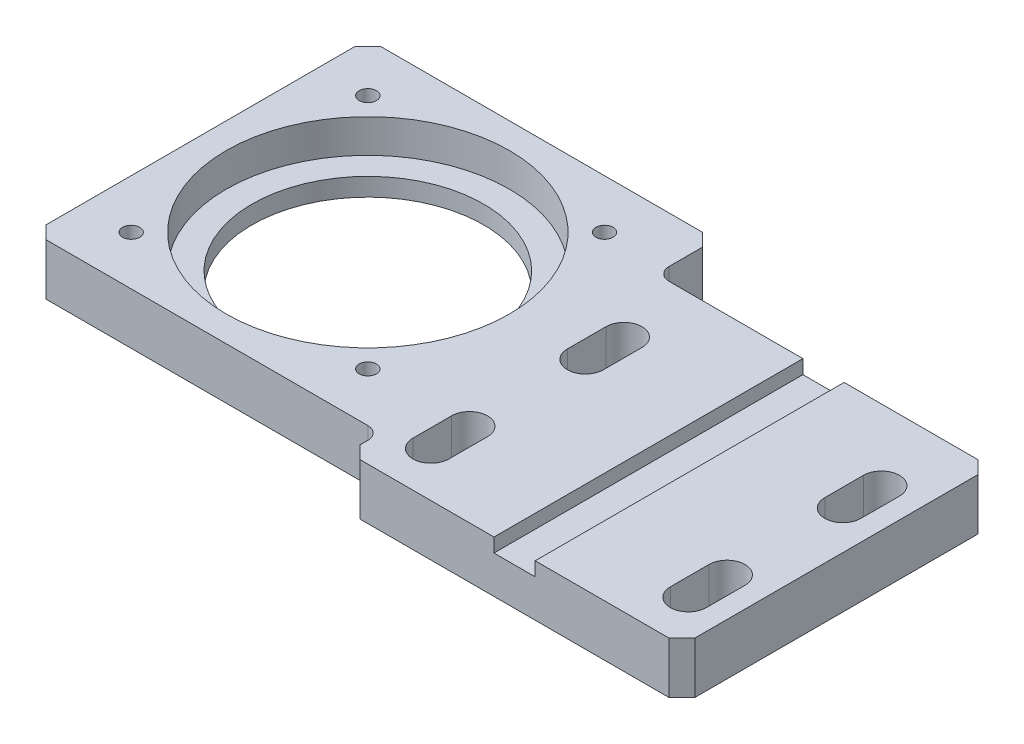
from build123d import *

# Parameters (mm, degrees)
EXTRUDE_1_DEPTH             = 20
SKETCH_3_R                  = 45
CUT_EXTRUDE_1_DEPTH         = 302.784691461
SKETCH_4_R                  = 55
CUT_EXTRUDE_2_DEPTH         = 13
SKETCH_5_W                  = 16
SKETCH_5_H                  = 120
CUT_EXTRUDE_3_DEPTH         = 5.4
CUT_EXTRUDE_4_DEPTH         = 302.784691461
PATTERN_LINEAR_1_COUNT      = 2
PATTERN_LINEAR_1_PITCH      = 60
PATTERN_LINEAR_1_COUNT_DIR2 = 2
PATTERN_LINEAR_1_PITCH_DIR2 = 100
FILLET_1_R                  = 5
CHAMFER_1_SIZE              = 5
SKETCH_7_R                  = 3.35
CUT_EXTRUDE_5_DEPTH         = 302.784691461


with BuildPart() as part:
    # 草图2 → 凸台-拉伸1 (new body)
    with BuildSketch(Plane(origin=(0, 0, 0), x_dir=(1, 0, 0), z_dir=(0, 1, 0))):
        Polygon((0, 0), (135, 0), (135, -23), (265, -23), (265, -143), (135, -143), (135, -130), (0, -130), align=None)
    extrude(amount=EXTRUDE_1_DEPTH)

    # 草图3 → 切除-拉伸1 (cut, through all)
    with BuildSketch(Plane(origin=(0, 20, 0), x_dir=(1, 0, 0), z_dir=(0, 1, 0))):
        with Locations((65, -65)):
            Circle(SKETCH_3_R)
    extrude(amount=-CUT_EXTRUDE_1_DEPTH, mode=Mode.SUBTRACT)

    # 草图4 → 切除-拉伸2 (cut)
    with BuildSketch(Plane(origin=(0, 20, 0), x_dir=(1, 0, 0), z_dir=(0, 1, 0))):
        with Locations((65, -65)):
            Circle(SKETCH_4_R)
    extrude(amount=-CUT_EXTRUDE_2_DEPTH, mode=Mode.SUBTRACT)

    # 草图5 → 切除-拉伸3 (cut)
    with BuildSketch(Plane(origin=(0, 20, 0), x_dir=(1, 0, 0), z_dir=(0, 1, 0))):
        with Locations((200, -83)):
            Rectangle(SKETCH_5_W, SKETCH_5_H)
    extrude(amount=-CUT_EXTRUDE_3_DEPTH, mode=Mode.SUBTRACT)

    # 草图6 → 切除-拉伸4 (cut, through all)
    with BuildSketch(Plane(origin=(0, 20, 0), x_dir=(1, 0, 0), z_dir=(0, 1, 0))):
        with BuildLine():
            Line((257, -110.5), (257, -125.5))
            ThreePointArc((257, -125.5), (250, -132.5), (243, -125.5))
            Line((243, -125.5), (243, -110.5))
            ThreePointArc((243, -110.5), (250, -103.5), (257, -110.5))
        make_face()
    cut_extrude_4 = extrude(amount=-CUT_EXTRUDE_4_DEPTH, mode=Mode.SUBTRACT)

    # 阵列(线性)1: Cut-Extrude 4 2 × 2
    with Locations(*[(-j * PATTERN_LINEAR_1_PITCH_DIR2, 0, -i * PATTERN_LINEAR_1_PITCH) for i in range(PATTERN_LINEAR_1_COUNT) for j in range(PATTERN_LINEAR_1_COUNT_DIR2) if (i, j) != (0, 0)]):
        add(cut_extrude_4, mode=Mode.SUBTRACT)

    # 圆角1
    fillet_1_edges = [part.edges().sort_by_distance(p)[0] for p in [
        (135, 10, 23),
        (135, 10, 130),
    ]]
    fillet(fillet_1_edges, radius=FILLET_1_R)

    # 倒角1
    chamfer_1_edges = [part.edges().sort_by_distance(p)[0] for p in [
        (265, 10, 23),
        (265, 10, 143),
        (135, 10, 143),
        (135, 10, 0),
        (0, 10, 130),
        (0, 10, 0),
    ]]
    chamfer(chamfer_1_edges, length=CHAMFER_1_SIZE)

    # 草图7 → 切除-拉伸5 (cut, through all)
    with BuildSketch(Plane(origin=(0, 20, 0), x_dir=(1, 0, 0), z_dir=(0, 1, 0))):
        with Locations((110.961940777, -19.038059223)):
            Circle(SKETCH_7_R)
        with Locations((110.961940777, -110.961940777)):
            Circle(SKETCH_7_R)
        with Locations((19.038059223, -110.961940777)):
            Circle(SKETCH_7_R)
        with Locations((19.038059223, -19.038059223)):
            Circle(SKETCH_7_R)
    extrude(amount=-CUT_EXTRUDE_5_DEPTH, mode=Mode.SUBTRACT)


solid = part.part
